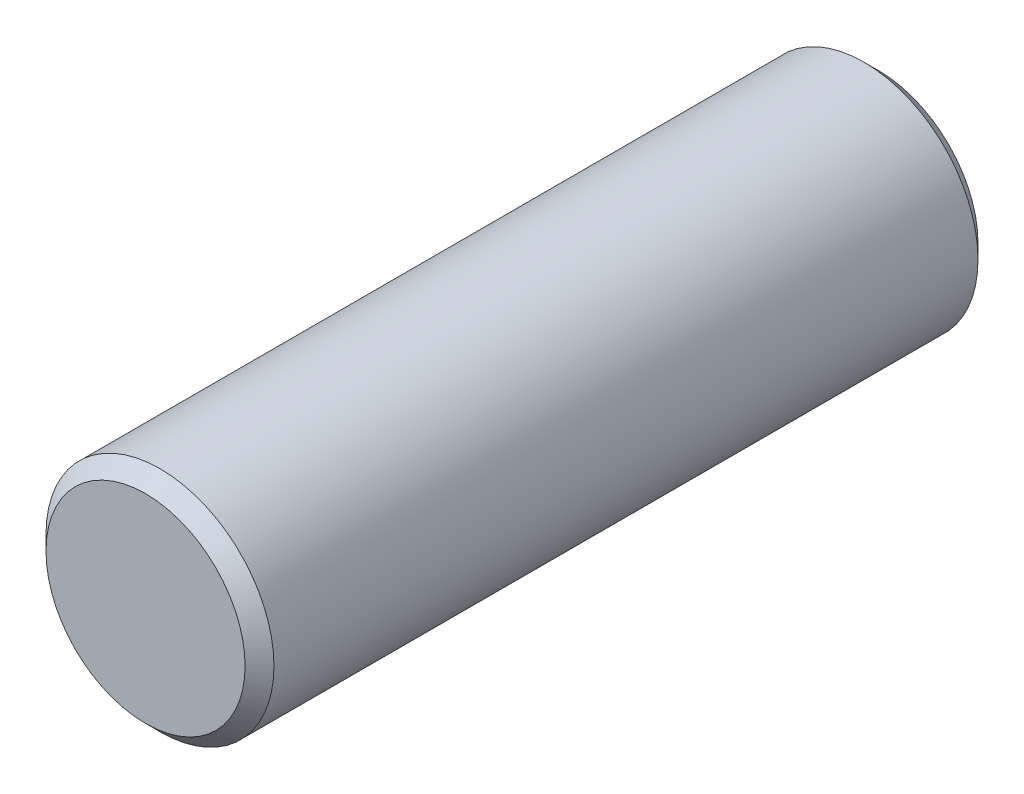
from build123d import *

# Parameters (mm, degrees)
SKETCH1_R           = 3.95
BOSS_EXTRUDE1_DEPTH = 12.7
CHAMFER1_SIZE       = 0.5


with BuildPart() as part:
    # Sketch1 → Boss-Extrude1 (new, symmetric)
    with BuildSketch(Plane.XY):
        Circle(SKETCH1_R)
    extrude(amount=BOSS_EXTRUDE1_DEPTH, both=True)

    # Chamfer1
    chamfer1_edges = [part.edges().sort_by_distance(p)[0] for p in [
        (-3.95, 0, -12.7),
        (-3.95, 0, 12.7),
    ]]
    chamfer(chamfer1_edges, length=CHAMFER1_SIZE)


solid = part.part
